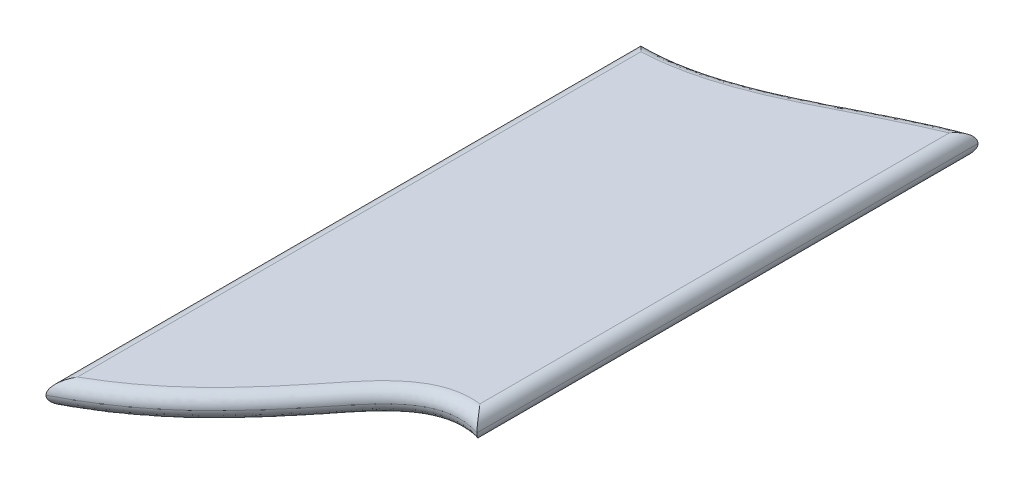
from build123d import *

# Parameters (mm, degrees)
BOSS_EXTRUDE1_DEPTH = 4
FILLET1_R           = 2


with BuildPart() as part:
    # Sketch1 → Boss-Extrude1 (new body)
    with BuildSketch(Plane(origin=(0, 0, 0), x_dir=(1, 0, 0), z_dir=(0, 1, 0))):
        with BuildLine():
            Line((280.6834877629392, 135.3327831160175), (280.6834877629392, 50.51914407331461))
            add(Edge.make_bspline(
                [(280.6834877629392, 50.51914407331461), (272.8146014241119, 53.116628917522746), (260.81709919961077, 36.673226934017094), (249.62805923058878, 25.04161414689709), (238.68540018583585, 19.58094259510333)],
                knots=[0, 0, 0, 0, 0.379628430394174, 1, 1, 1, 1], degree=3))
            Line((238.68540018583585, 19.58094259510333), (238.68540018583585, 120.27845995679259))
            add(Edge.make_bspline(
                [(238.68540018583585, 120.27845995679259), (254.16770230163453, 119.90607764055265), (266.76814112043115, 130.4999598230037), (280.6834877629392, 135.3327831160175)],
                knots=[0, 0, 0, 0, 1, 1, 1, 1], degree=3))
        make_face()
    extrude(amount=BOSS_EXTRUDE1_DEPTH)

    # Fillet1
    fillet1_edges = [part.edges().sort_by_distance(p)[0] for p in [
        (280.6834877629392, 0, -92.92596359466606),
        (260.27205227687153, 0, -125.8536694329349),
        (238.68540018583585, 0, -69.92970127594796),
        (259.60392649621997, 0, -36.255471168100065),
        (238.68540018583585, 4, -69.92970127594796),
        (260.27205227687153, 4, -125.8536694329349),
        (280.6834877629392, 4, -92.92596359466606),
        (259.60392649621997, 4, -36.255471168100065),
    ]]
    fillet(fillet1_edges, radius=FILLET1_R - 0.0001)  # a hair under: the kernel refuses the full size


solid = part.part
